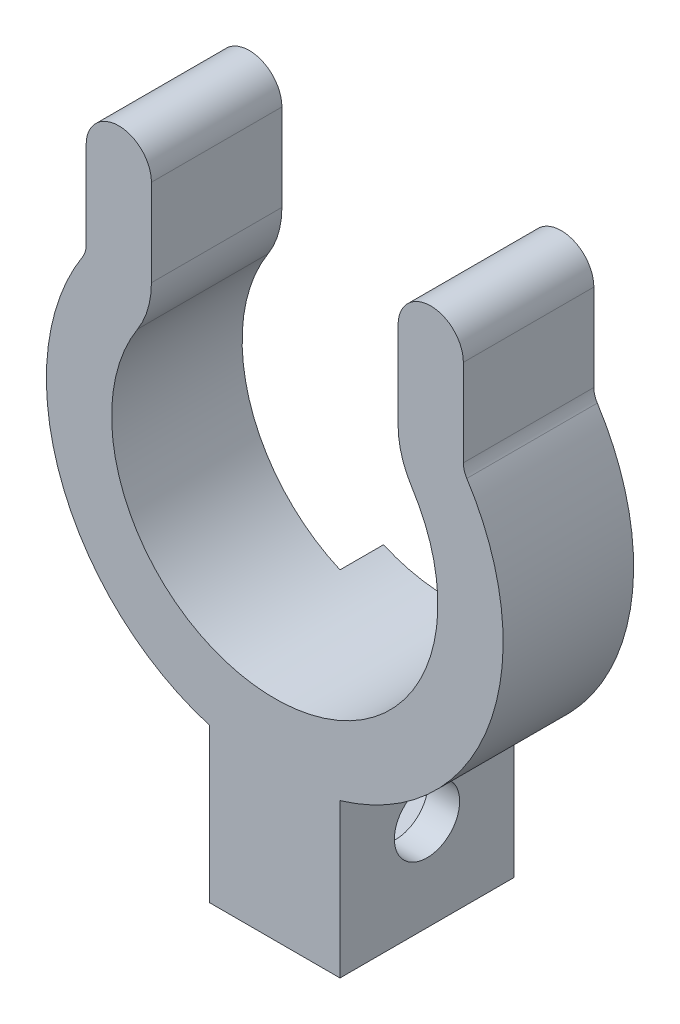
from build123d import *

# Parameters (mm, degrees)
BOSS_EXTRUDE1_DEPTH = 6
BOSS_EXTRUDE2_START = -8
BOSS_EXTRUDE2_DEPTH = 8
SKETCH4_W           = 3.1
SKETCH4_H           = 6.1
CUT_EXTRUDE3_DEPTH  = 7.5
SKETCH5_R           = 1.5
CUT_EXTRUDE2_DEPTH  = 10


with BuildPart() as part:
    # Sketch1 → Boss-Extrude1 (new body)
    with BuildSketch(Plane.XY):
        with BuildLine():
            Line((-5.671239551, 6.2223087), (-5.671239551, 10.2223087))
            ThreePointArc((-5.671239551, 10.2223087), (-7.171239551, 11.7223087), (-8.671239551, 10.2223087))
            Line((-8.671239551, 10.2223087), (-8.671239551, 6.2223087))
            ThreePointArc((-8.671239551, 6.2223087), (-8.71181854, 5.940331176), (-8.830262198, 5.681238378))
            ThreePointArc((-8.830262198, 5.681238378), (0, -10.5), (8.830262198, 5.681238378))
            ThreePointArc((8.830262198, 5.681238378), (8.71181854, 5.940331176), (8.671239551, 6.2223087))
            Line((8.671239551, 6.2223087), (8.671239551, 10.2223087))
            ThreePointArc((8.671239551, 10.2223087), (7.171239551, 11.7223087), (5.671239551, 10.2223087))
            Line((5.671239551, 10.2223087), (5.671239551, 6.2223087))
            ThreePointArc((5.671239551, 6.2223087), (5.833555507, 5.094398605), (6.307330142, 4.058027413))
            ThreePointArc((6.307330142, 4.058027413), (0, -7.5), (-6.307330142, 4.058027413))
            ThreePointArc((-6.307330142, 4.058027413), (-5.833555507, 5.094398605), (-5.671239551, 6.2223087))
        make_face()
    extrude(amount=BOSS_EXTRUDE1_DEPTH)

    # Sketch2 → Boss-Extrude2 (add)
    with BuildSketch(Plane.XY.offset(6).offset(BOSS_EXTRUDE2_START)):
        with BuildLine():
            Line((3, -14.126136458), (3, -6.873863542))
            ThreePointArc((3, -6.873863542), (0, -7.5), (-3, -6.873863542))
            Line((-3, -6.873863542), (-3, -14.126136458))
            Line((-3, -14.126136458), (-3, -17.126136458))
            Line((-3, -17.126136458), (3, -17.126136458))
            Line((3, -17.126136458), (3, -14.126136458))
        make_face()
    extrude(amount=BOSS_EXTRUDE2_DEPTH)

    # Sketch4 → Cut-Extrude3 (cut)
    with BuildSketch(Plane(origin=(0, 0, -2), x_dir=(-1, 0, 0), z_dir=(0, 0, -1))):
        with Locations((0, -12.842305899)):
            Rectangle(SKETCH4_W, SKETCH4_H)
    extrude(amount=-CUT_EXTRUDE3_DEPTH, mode=Mode.SUBTRACT)

    # Sketch5 → Cut-Extrude2 (cut)
    with BuildSketch(Plane.ZY.offset(3)):
        with Locations((2, -12.842305899)):
            Circle(SKETCH5_R)
    extrude(amount=-CUT_EXTRUDE2_DEPTH, mode=Mode.SUBTRACT)


solid = part.part
